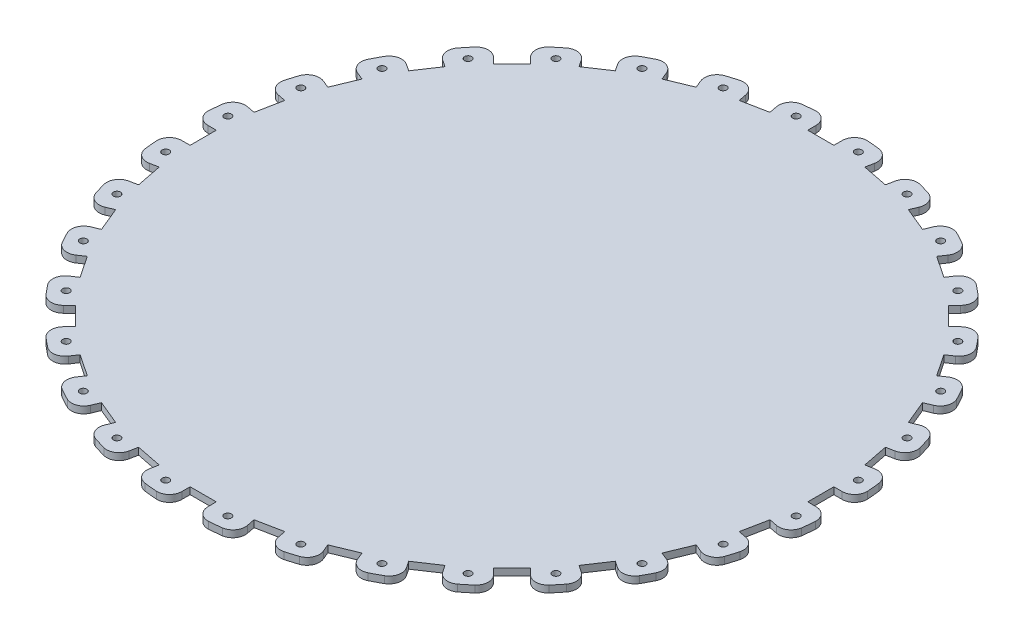
from build123d import *

# Parameters (mm, degrees)
BOSS_EXTRUDE1_DEPTH = 3.175
SKETCH5_R           = 1.6383
CUT_EXTRUDE1_DEPTH  = 216.365801488
CUT_EXTRUDE2_DEPTH  = 216.365801488
CIRPATTERN2_COUNT   = 32


with BuildPart() as part:
    # Sketch1 → Boss-Extrude1 (new body)
    with BuildSketch(Plane(origin=(0, 0, 0), x_dir=(1, 0, 0), z_dir=(0, 1, 0))):
        with BuildLine():
            Line((142.367, 6.0325), (152.016068998, 6.0325))
            ThreePointArc((152.016068998, 6.0325), (152.199347104, 6.110644559), (152.269852085, 6.296994992))
            ThreePointArc((152.269852085, 6.296994992), (151.666152345, 14.937812186), (150.572512355, 23.530374478))
            ThreePointArc((150.572512355, 23.530374478), (150.467006941, 23.6993894), (150.272005226, 23.740276649))
            Line((150.272005226, 23.740276649), (140.808340383, 21.85783667))
            Line((140.808340383, 21.85783667), (138.454575648, 33.691011079))
            Line((138.454575648, 33.691011079), (147.918240491, 35.573451057))
            ThreePointArc((147.918240491, 35.573451057), (148.082751712, 35.685849875), (148.115546794, 35.882374475))
            ThreePointArc((148.115546794, 35.882374475), (145.837707166, 44.239384814), (143.088755417, 52.453484853))
            ThreePointArc((143.088755417, 52.453484853), (142.952304085, 52.598669115), (142.753072566, 52.600727779))
            Line((142.753072566, 52.600727779), (133.838495211, 48.908188936))
            Line((133.838495211, 48.908188936), (129.221419599, 60.054795495))
            Line((129.221419599, 60.054795495), (138.135996955, 63.747334339))
            ThreePointArc((138.135996955, 63.747334339), (138.275419217, 63.889667992), (138.269244103, 64.088814431))
            ThreePointArc((138.269244103, 64.088814431), (134.404800687, 71.840862692), (130.106177854, 79.360837221))
            ThreePointArc((130.106177854, 79.360837221), (129.944024351, 79.476611473), (129.748219385, 79.43976244))
            Line((129.748219385, 79.43976244), (121.725311725, 74.079026928))
            Line((121.725311725, 74.079026928), (115.022356864, 84.110707801))
            Line((115.022356864, 84.110707801), (123.045264523, 89.471443312))
            ThreePointArc((123.045264523, 89.471443312), (123.154239908, 89.638241999), (123.109331904, 89.832357189))
            ThreePointArc((123.109331904, 89.832357189), (117.806793092, 96.681536507), (112.123692839, 103.21839712))
            ThreePointArc((112.123692839, 103.21839712), (111.942068635, 103.300312224), (111.757214896, 103.225971581))
            Line((111.757214896, 103.225971581), (104.934292775, 96.40304946))
            Line((104.934292775, 96.40304946), (96.40304946, 104.934292775))
            Line((96.40304946, 104.934292775), (103.225971581, 111.757214896))
            ThreePointArc((103.225971581, 111.757214896), (103.300312224, 111.942068635), (103.21839712, 112.123692839))
            ThreePointArc((103.21839712, 112.123692839), (96.681536507, 117.806793092), (89.832357189, 123.109331904))
            ThreePointArc((89.832357189, 123.109331904), (89.638241999, 123.154239908), (89.471443312, 123.045264523))
            Line((89.471443312, 123.045264523), (84.110707801, 115.022356864))
            Line((84.110707801, 115.022356864), (74.079026928, 121.725311725))
            Line((74.079026928, 121.725311725), (79.43976244, 129.748219385))
            ThreePointArc((79.43976244, 129.748219385), (79.476611473, 129.944024351), (79.360837221, 130.106177854))
            ThreePointArc((79.360837221, 130.106177854), (71.840862692, 134.404800687), (64.088814431, 138.269244103))
            ThreePointArc((64.088814431, 138.269244103), (63.889667992, 138.275419217), (63.747334339, 138.135996955))
            Line((63.747334339, 138.135996955), (60.054795495, 129.221419599))
            Line((60.054795495, 129.221419599), (48.908188936, 133.838495211))
            Line((48.908188936, 133.838495211), (52.600727779, 142.753072566))
            ThreePointArc((52.600727779, 142.753072566), (52.598669115, 142.952304085), (52.453484853, 143.088755417))
            ThreePointArc((52.453484853, 143.088755417), (44.239384814, 145.837707166), (35.882374475, 148.115546794))
            ThreePointArc((35.882374475, 148.115546794), (35.685849875, 148.082751712), (35.573451057, 147.918240491))
            Line((35.573451057, 147.918240491), (33.691011079, 138.454575648))
            Line((33.691011079, 138.454575648), (21.85783667, 140.808340383))
            Line((21.85783667, 140.808340383), (23.740276649, 150.272005226))
            ThreePointArc((23.740276649, 150.272005226), (23.6993894, 150.467006941), (23.530374478, 150.572512355))
            ThreePointArc((23.530374478, 150.572512355), (14.937812186, 151.666152345), (6.296994992, 152.269852085))
            ThreePointArc((6.296994992, 152.269852085), (6.110644559, 152.199347104), (6.0325, 152.016068998))
            Line((6.0325, 152.016068998), (6.0325, 142.367))
            Line((6.0325, 142.367), (-6.0325, 142.367))
            Line((-6.0325, 142.367), (-6.0325, 152.016068998))
            ThreePointArc((-6.0325, 152.016068998), (-6.110644559, 152.199347104), (-6.296994992, 152.269852085))
            ThreePointArc((-6.296994992, 152.269852085), (-14.937812186, 151.666152345), (-23.530374478, 150.572512355))
            ThreePointArc((-23.530374478, 150.572512355), (-23.6993894, 150.467006941), (-23.740276649, 150.272005226))
            Line((-23.740276649, 150.272005226), (-21.85783667, 140.808340383))
            Line((-21.85783667, 140.808340383), (-33.691011079, 138.454575648))
            Line((-33.691011079, 138.454575648), (-35.573451057, 147.918240491))
            ThreePointArc((-35.573451057, 147.918240491), (-35.685849875, 148.082751712), (-35.882374475, 148.115546794))
            ThreePointArc((-35.882374475, 148.115546794), (-44.239384814, 145.837707166), (-52.453484853, 143.088755417))
            ThreePointArc((-52.453484853, 143.088755417), (-52.598669115, 142.952304085), (-52.600727779, 142.753072566))
            Line((-52.600727779, 142.753072566), (-48.908188936, 133.838495211))
            Line((-48.908188936, 133.838495211), (-60.054795495, 129.221419599))
            Line((-60.054795495, 129.221419599), (-63.747334339, 138.135996955))
            ThreePointArc((-63.747334339, 138.135996955), (-63.889667992, 138.275419217), (-64.088814431, 138.269244103))
            ThreePointArc((-64.088814431, 138.269244103), (-71.840862692, 134.404800687), (-79.360837221, 130.106177854))
            ThreePointArc((-79.360837221, 130.106177854), (-79.476611473, 129.944024351), (-79.43976244, 129.748219385))
            Line((-79.43976244, 129.748219385), (-74.079026928, 121.725311725))
            Line((-74.079026928, 121.725311725), (-84.110707801, 115.022356864))
            Line((-84.110707801, 115.022356864), (-89.471443312, 123.045264523))
            ThreePointArc((-89.471443312, 123.045264523), (-89.638241999, 123.154239908), (-89.832357189, 123.109331904))
            ThreePointArc((-89.832357189, 123.109331904), (-96.681536507, 117.806793092), (-103.21839712, 112.123692839))
            ThreePointArc((-103.21839712, 112.123692839), (-103.300312224, 111.942068635), (-103.225971581, 111.757214896))
            Line((-103.225971581, 111.757214896), (-96.40304946, 104.934292775))
            Line((-96.40304946, 104.934292775), (-104.934292775, 96.40304946))
            Line((-104.934292775, 96.40304946), (-111.757214896, 103.225971581))
            ThreePointArc((-111.757214896, 103.225971581), (-111.942068635, 103.300312224), (-112.123692839, 103.21839712))
            ThreePointArc((-112.123692839, 103.21839712), (-117.806793092, 96.681536507), (-123.109331904, 89.832357189))
            ThreePointArc((-123.109331904, 89.832357189), (-123.154239908, 89.638241999), (-123.045264523, 89.471443312))
            Line((-123.045264523, 89.471443312), (-115.022356864, 84.110707801))
            Line((-115.022356864, 84.110707801), (-121.725311725, 74.079026928))
            Line((-121.725311725, 74.079026928), (-129.748219385, 79.43976244))
            ThreePointArc((-129.748219385, 79.43976244), (-129.944024351, 79.476611473), (-130.106177854, 79.360837221))
            ThreePointArc((-130.106177854, 79.360837221), (-134.404800687, 71.840862692), (-138.269244103, 64.088814431))
            ThreePointArc((-138.269244103, 64.088814431), (-138.275419217, 63.889667992), (-138.135996955, 63.747334339))
            Line((-138.135996955, 63.747334339), (-129.221419599, 60.054795495))
            Line((-129.221419599, 60.054795495), (-133.838495211, 48.908188936))
            Line((-133.838495211, 48.908188936), (-142.753072566, 52.600727779))
            ThreePointArc((-142.753072566, 52.600727779), (-142.952304085, 52.598669115), (-143.088755417, 52.453484853))
            ThreePointArc((-143.088755417, 52.453484853), (-145.837707166, 44.239384814), (-148.115546794, 35.882374475))
            ThreePointArc((-148.115546794, 35.882374475), (-148.082751712, 35.685849875), (-147.918240491, 35.573451057))
            Line((-147.918240491, 35.573451057), (-138.454575648, 33.691011079))
            Line((-138.454575648, 33.691011079), (-140.808340383, 21.85783667))
            Line((-140.808340383, 21.85783667), (-150.272005226, 23.740276649))
            ThreePointArc((-150.272005226, 23.740276649), (-150.467006941, 23.6993894), (-150.572512355, 23.530374478))
            ThreePointArc((-150.572512355, 23.530374478), (-151.666152345, 14.937812186), (-152.269852085, 6.296994992))
            ThreePointArc((-152.269852085, 6.296994992), (-152.199347104, 6.110644559), (-152.016068998, 6.0325))
            Line((-152.016068998, 6.0325), (-142.367, 6.0325))
            Line((-142.367, 6.0325), (-142.367, -6.0325))
            Line((-142.367, -6.0325), (-152.016068998, -6.0325))
            ThreePointArc((-152.016068998, -6.0325), (-152.199347104, -6.110644559), (-152.269852085, -6.296994992))
            ThreePointArc((-152.269852085, -6.296994992), (-151.666152345, -14.937812186), (-150.572512355, -23.530374478))
            ThreePointArc((-150.572512355, -23.530374478), (-150.467006941, -23.6993894), (-150.272005226, -23.740276649))
            Line((-150.272005226, -23.740276649), (-140.808340383, -21.85783667))
            Line((-140.808340383, -21.85783667), (-138.454575648, -33.691011079))
            Line((-138.454575648, -33.691011079), (-147.918240491, -35.573451057))
            ThreePointArc((-147.918240491, -35.573451057), (-148.082751712, -35.685849875), (-148.115546794, -35.882374475))
            ThreePointArc((-148.115546794, -35.882374475), (-145.837707166, -44.239384814), (-143.088755417, -52.453484853))
            ThreePointArc((-143.088755417, -52.453484853), (-142.952304085, -52.598669115), (-142.753072566, -52.600727779))
            Line((-142.753072566, -52.600727779), (-133.838495211, -48.908188936))
            Line((-133.838495211, -48.908188936), (-129.221419599, -60.054795495))
            Line((-129.221419599, -60.054795495), (-138.135996955, -63.747334339))
            ThreePointArc((-138.135996955, -63.747334339), (-138.275419217, -63.889667992), (-138.269244103, -64.088814431))
            ThreePointArc((-138.269244103, -64.088814431), (-134.404800687, -71.840862692), (-130.106177854, -79.360837221))
            ThreePointArc((-130.106177854, -79.360837221), (-129.944024351, -79.476611473), (-129.748219385, -79.43976244))
            Line((-129.748219385, -79.43976244), (-121.725311725, -74.079026928))
            Line((-121.725311725, -74.079026928), (-115.022356864, -84.110707801))
            Line((-115.022356864, -84.110707801), (-123.045264523, -89.471443312))
            ThreePointArc((-123.045264523, -89.471443312), (-123.154239908, -89.638241999), (-123.109331904, -89.832357189))
            ThreePointArc((-123.109331904, -89.832357189), (-117.806793092, -96.681536507), (-112.123692839, -103.21839712))
            ThreePointArc((-112.123692839, -103.21839712), (-111.942068635, -103.300312224), (-111.757214896, -103.225971581))
            Line((-111.757214896, -103.225971581), (-104.934292775, -96.40304946))
            Line((-104.934292775, -96.40304946), (-96.40304946, -104.934292775))
            Line((-96.40304946, -104.934292775), (-103.225971581, -111.757214896))
            ThreePointArc((-103.225971581, -111.757214896), (-103.300312224, -111.942068635), (-103.21839712, -112.123692839))
            ThreePointArc((-103.21839712, -112.123692839), (-96.681536507, -117.806793092), (-89.832357189, -123.109331904))
            ThreePointArc((-89.832357189, -123.109331904), (-89.638241999, -123.154239908), (-89.471443312, -123.045264523))
            Line((-89.471443312, -123.045264523), (-84.110707801, -115.022356864))
            Line((-84.110707801, -115.022356864), (-74.079026928, -121.725311725))
            Line((-74.079026928, -121.725311725), (-79.43976244, -129.748219385))
            ThreePointArc((-79.43976244, -129.748219385), (-79.476611473, -129.944024351), (-79.360837221, -130.106177854))
            ThreePointArc((-79.360837221, -130.106177854), (-71.840862692, -134.404800687), (-64.088814431, -138.269244103))
            ThreePointArc((-64.088814431, -138.269244103), (-63.889667992, -138.275419217), (-63.747334339, -138.135996955))
            Line((-63.747334339, -138.135996955), (-60.054795495, -129.221419599))
            Line((-60.054795495, -129.221419599), (-48.908188936, -133.838495211))
            Line((-48.908188936, -133.838495211), (-52.600727779, -142.753072566))
            ThreePointArc((-52.600727779, -142.753072566), (-52.598669115, -142.952304085), (-52.453484853, -143.088755417))
            ThreePointArc((-52.453484853, -143.088755417), (-44.239384814, -145.837707166), (-35.882374475, -148.115546794))
            ThreePointArc((-35.882374475, -148.115546794), (-35.685849875, -148.082751712), (-35.573451057, -147.918240491))
            Line((-35.573451057, -147.918240491), (-33.691011079, -138.454575648))
            Line((-33.691011079, -138.454575648), (-21.85783667, -140.808340383))
            Line((-21.85783667, -140.808340383), (-23.740276649, -150.272005226))
            ThreePointArc((-23.740276649, -150.272005226), (-23.6993894, -150.467006941), (-23.530374478, -150.572512355))
            ThreePointArc((-23.530374478, -150.572512355), (-14.937812186, -151.666152345), (-6.296994992, -152.269852085))
            ThreePointArc((-6.296994992, -152.269852085), (-6.110644559, -152.199347104), (-6.0325, -152.016068998))
            Line((-6.0325, -152.016068998), (-6.0325, -142.367))
            Line((-6.0325, -142.367), (6.0325, -142.367))
            Line((6.0325, -142.367), (6.0325, -152.016068998))
            ThreePointArc((6.0325, -152.016068998), (6.110644559, -152.199347104), (6.296994992, -152.269852085))
            ThreePointArc((6.296994992, -152.269852085), (14.937812186, -151.666152345), (23.530374478, -150.572512355))
            ThreePointArc((23.530374478, -150.572512355), (23.6993894, -150.467006941), (23.740276649, -150.272005226))
            Line((23.740276649, -150.272005226), (21.85783667, -140.808340383))
            Line((21.85783667, -140.808340383), (33.691011079, -138.454575648))
            Line((33.691011079, -138.454575648), (35.573451057, -147.918240491))
            ThreePointArc((35.573451057, -147.918240491), (35.685849875, -148.082751712), (35.882374475, -148.115546794))
            ThreePointArc((35.882374475, -148.115546794), (44.239384814, -145.837707166), (52.453484853, -143.088755417))
            ThreePointArc((52.453484853, -143.088755417), (52.598669115, -142.952304085), (52.600727779, -142.753072566))
            Line((52.600727779, -142.753072566), (48.908188936, -133.838495211))
            Line((48.908188936, -133.838495211), (60.054795495, -129.221419599))
            Line((60.054795495, -129.221419599), (63.747334339, -138.135996955))
            ThreePointArc((63.747334339, -138.135996955), (63.889667992, -138.275419217), (64.088814431, -138.269244103))
            ThreePointArc((64.088814431, -138.269244103), (71.840862692, -134.404800687), (79.360837221, -130.106177854))
            ThreePointArc((79.360837221, -130.106177854), (79.476611473, -129.944024351), (79.43976244, -129.748219385))
            Line((79.43976244, -129.748219385), (74.079026928, -121.725311725))
            Line((74.079026928, -121.725311725), (84.110707801, -115.022356864))
            Line((84.110707801, -115.022356864), (89.471443312, -123.045264523))
            ThreePointArc((89.471443312, -123.045264523), (89.638241999, -123.154239908), (89.832357189, -123.109331904))
            ThreePointArc((89.832357189, -123.109331904), (96.681536507, -117.806793092), (103.21839712, -112.123692839))
            ThreePointArc((103.21839712, -112.123692839), (103.300312224, -111.942068635), (103.225971581, -111.757214896))
            Line((103.225971581, -111.757214896), (96.40304946, -104.934292775))
            Line((96.40304946, -104.934292775), (104.934292775, -96.40304946))
            Line((104.934292775, -96.40304946), (111.757214896, -103.225971581))
            ThreePointArc((111.757214896, -103.225971581), (111.942068635, -103.300312224), (112.123692839, -103.21839712))
            ThreePointArc((112.123692839, -103.21839712), (117.806793092, -96.681536507), (123.109331904, -89.832357189))
            ThreePointArc((123.109331904, -89.832357189), (123.154239908, -89.638241999), (123.045264523, -89.471443312))
            Line((123.045264523, -89.471443312), (115.022356864, -84.110707801))
            Line((115.022356864, -84.110707801), (121.725311725, -74.079026928))
            Line((121.725311725, -74.079026928), (129.748219385, -79.43976244))
            ThreePointArc((129.748219385, -79.43976244), (129.944024351, -79.476611473), (130.106177854, -79.360837221))
            ThreePointArc((130.106177854, -79.360837221), (134.404800687, -71.840862692), (138.269244103, -64.088814431))
            ThreePointArc((138.269244103, -64.088814431), (138.275419217, -63.889667992), (138.135996955, -63.747334339))
            Line((138.135996955, -63.747334339), (129.221419599, -60.054795495))
            Line((129.221419599, -60.054795495), (133.838495211, -48.908188936))
            Line((133.838495211, -48.908188936), (142.753072566, -52.600727779))
            ThreePointArc((142.753072566, -52.600727779), (142.952304085, -52.598669115), (143.088755417, -52.453484853))
            ThreePointArc((143.088755417, -52.453484853), (145.837707166, -44.239384814), (148.115546794, -35.882374475))
            ThreePointArc((148.115546794, -35.882374475), (148.082751712, -35.685849875), (147.918240491, -35.573451057))
            Line((147.918240491, -35.573451057), (138.454575648, -33.691011079))
            Line((138.454575648, -33.691011079), (140.808340383, -21.85783667))
            Line((140.808340383, -21.85783667), (150.272005226, -23.740276649))
            ThreePointArc((150.272005226, -23.740276649), (150.467006941, -23.6993894), (150.572512355, -23.530374478))
            ThreePointArc((150.572512355, -23.530374478), (151.666152345, -14.937812186), (152.269852085, -6.296994992))
            ThreePointArc((152.269852085, -6.296994992), (152.199347104, -6.110644559), (152.016068998, -6.0325))
            Line((152.016068998, -6.0325), (142.367, -6.0325))
            Line((142.367, -6.0325), (142.367, 6.0325))
        make_face()
    extrude(amount=BOSS_EXTRUDE1_DEPTH)

    # Sketch5 → Cut-Extrude1 (cut, through all)
    with BuildSketch(Plane.XZ):
        with Locations((-112.898176714, 92.653139152)):
            Circle(SKETCH5_R)
    cut_extrude1 = extrude(amount=-CUT_EXTRUDE1_DEPTH, mode=Mode.SUBTRACT)

    # Sketch5<3> → Cut-Extrude2 (cut, through all)
    with BuildSketch(Plane.XZ):
        with BuildLine():
            Line((-107.628369611, 99.097126296), (-111.944238253, 103.412994938))
            ThreePointArc((-111.944238253, 103.412994938), (-113.978548188, 101.16644974), (-115.967781599, 98.879894978))
            ThreePointArc((-115.967781599, 98.879894978), (-111.844731757, 100.779619198), (-107.628369611, 99.097126296))
        make_face()
        with BuildLine():
            ThreePointArc((-119.604137378, 94.448982641), (-121.458676444, 92.051887088), (-123.265180726, 89.618386621))
            Line((-123.265180726, 89.618386621), (-118.190256087, 86.227430388))
            ThreePointArc((-118.190256087, 86.227430388), (-120.662991808, 90.034538236), (-119.604137378, 94.448982641))
        make_face()
    cut_extrude2 = extrude(amount=-CUT_EXTRUDE2_DEPTH, mode=Mode.SUBTRACT)

    # CirPattern2: Cut-Extrude1, Cut-Extrude2 ×32 about axis
    cirpattern2_axis = Axis((0, 50, 0), (0, -1, 0))
    add([cut_extrude1.rotate(cirpattern2_axis, i * 360 / CIRPATTERN2_COUNT) for i in range(1, CIRPATTERN2_COUNT)], mode=Mode.SUBTRACT)
    add([cut_extrude2.rotate(cirpattern2_axis, i * 360 / CIRPATTERN2_COUNT) for i in range(1, CIRPATTERN2_COUNT)], mode=Mode.SUBTRACT)


solid = part.part
